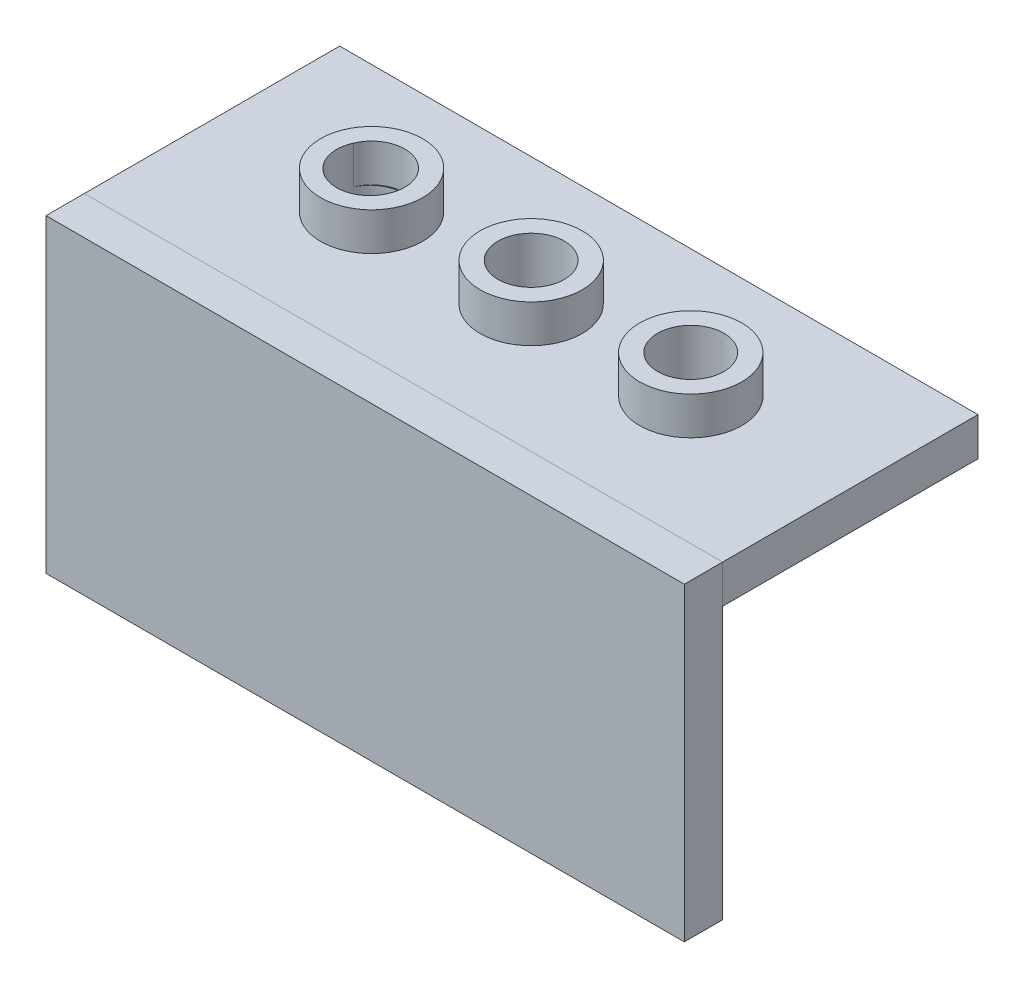
from build123d import *

# Parameters (mm, degrees)
SKETCH1_W               = 50
SKETCH1_H               = 20
BOSS_EXTRUDE2_DEPTH     = 3
SKETCH3_R               = 4
BOSS_EXTRUDE3_DEPTH     = 6.27
CUT_EXTRUDE1_DEPTH      = 29.476883608
CUT_EXTRUDE1_DEPTH_BACK = 29.476883608
SKETCH4_R               = 2.6
SKETCH5_W               = 20
SKETCH5_H               = 2.3
BOSS_EXTRUDE4_DEPTH     = 50
CUT_EXTRUDE2_DEPTH      = 52.825986725
CUT_EXTRUDE2_DEPTH_BACK = 52.825986725
SKETCH6_W               = 20
SKETCH6_H               = 2.65
CUT_EXTRUDE3_DEPTH      = 28.727682918
CUT_EXTRUDE3_DEPTH_BACK = 28.727682918
SKETCH7_R               = 2.6
BOSS_EXTRUDE5_DEPTH     = 50
CUT_EXTRUDE4_DEPTH      = 28.173621503
CUT_EXTRUDE4_DEPTH_BACK = 28.173621503
SKETCH10_R              = 2.6
CUT_EXTRUDE5_DEPTH      = 52.826789459
CUT_EXTRUDE5_DEPTH_BACK = 52.826789459
BOSS_EXTRUDE6_DEPTH     = 50


with BuildPart() as part:
    # Sketch1 → Boss-Extrude2 (new body)
    with BuildSketch(Plane(origin=(0, 0, 0), x_dir=(1, 0, 0), z_dir=(0, 1, 0))):
        Rectangle(SKETCH1_W, SKETCH1_H)
    extrude(amount=BOSS_EXTRUDE2_DEPTH)

    # Sketch3 → Boss-Extrude3 (add)
    with BuildSketch(Plane(origin=(0, 3, 0), x_dir=(1, 0, 0), z_dir=(0, 1, 0))):
        Circle(SKETCH3_R)
        with Locations((-12.5, 0)):
            Circle(SKETCH3_R)
        with Locations((12.5, 0)):
            Circle(SKETCH3_R)
    extrude(amount=BOSS_EXTRUDE3_DEPTH)

    # Sketch4 → Cut-Extrude1 (cut, two sides: drawn at the far end of the back side and taken through both)
    with BuildSketch(Plane(origin=(0, 9.27, 0), x_dir=(1, 0, 0), z_dir=(0, 1, 0)).offset(-CUT_EXTRUDE1_DEPTH_BACK)):
        Circle(SKETCH4_R)
        with Locations((-12.5, 0)):
            Circle(SKETCH4_R)
        with Locations((12.5, 0)):
            Circle(SKETCH4_R)
    extrude(amount=CUT_EXTRUDE1_DEPTH + CUT_EXTRUDE1_DEPTH_BACK, mode=Mode.SUBTRACT)

    # Sketch5 → Boss-Extrude4 (add)
    with BuildSketch(Plane.ZY.offset(25)):
        with Locations((0, 4.15)):
            Rectangle(SKETCH5_W, SKETCH5_H)
    extrude(amount=-BOSS_EXTRUDE4_DEPTH)

    # Sketch6 → Cut-Extrude2 (cut, two sides: drawn at the far end of the back side and taken through both)
    with BuildSketch(Plane.ZY.offset(25).offset(-CUT_EXTRUDE2_DEPTH_BACK)):
        with Locations((0, 1.325)):
            Rectangle(SKETCH6_W, SKETCH6_H)
    extrude(amount=CUT_EXTRUDE2_DEPTH + CUT_EXTRUDE2_DEPTH_BACK, mode=Mode.SUBTRACT)

    # Sketch7 → Cut-Extrude3 (cut, two sides: drawn at the far end of the back side and taken through both)
    with BuildSketch(Plane.XZ.offset(-2.65).offset(-CUT_EXTRUDE3_DEPTH_BACK)):
        with Locations((-12.5, 0)):
            Circle(SKETCH7_R)
        Circle(SKETCH7_R)
        with Locations((12.5, 0)):
            Circle(SKETCH7_R)
    extrude(amount=CUT_EXTRUDE3_DEPTH + CUT_EXTRUDE3_DEPTH_BACK, mode=Mode.SUBTRACT)

    # Sketch8 → Boss-Extrude5 (add)
    with BuildSketch(Plane.ZY.offset(25)):
        Polygon((-10, 2.65), (10, 2.65), (10.004159415, 6.3), (-10, 6.3), align=None)
    extrude(amount=-BOSS_EXTRUDE5_DEPTH)

    # Sketch10 → Cut-Extrude4 (cut, two sides: drawn at the far end of the back side and taken through both)
    with BuildSketch(Plane(origin=(0, 6.3, 0), x_dir=(1, 0, 0), z_dir=(0, 1, 0)).offset(-CUT_EXTRUDE4_DEPTH_BACK)):
        with Locations((12.5, 0)):
            Circle(SKETCH10_R)
        Circle(SKETCH10_R)
        with Locations((-12.542506815, -0.096829386)):
            Circle(SKETCH10_R)
    extrude(amount=CUT_EXTRUDE4_DEPTH + CUT_EXTRUDE4_DEPTH_BACK, mode=Mode.SUBTRACT)

    # Sketch11 → Cut-Extrude5 (cut, two sides: drawn at the far end of the back side and taken through both)
    with BuildSketch(Plane.ZY.offset(25).offset(-CUT_EXTRUDE5_DEPTH_BACK)):
        Polygon((10, 2.65), (10.000740717, 3.299999578), (-10, 3.299999578), (-10, 2.65), align=None)
    extrude(amount=CUT_EXTRUDE5_DEPTH + CUT_EXTRUDE5_DEPTH_BACK, mode=Mode.SUBTRACT)


with BuildPart() as body_2:
    # Sketch12 → Boss-Extrude6 (new body)
    with BuildSketch(Plane.ZY.offset(25)):
        Polygon((10.004159415, 6.3), (13.004159415, 6.3), (13.004159415, -17.969335025), (10.000740717, -17.969335025), align=None)
    extrude(amount=-BOSS_EXTRUDE6_DEPTH)


solid = Compound([part.part, body_2.part])
